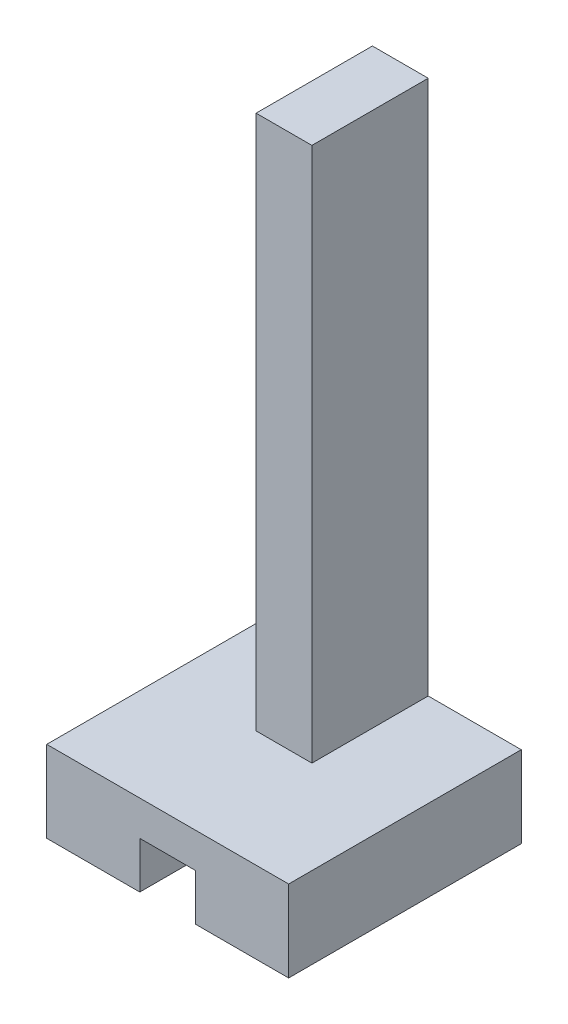
from build123d import *

# Parameters (mm, degrees)
SKIZZE1_W                       = 1040
SKIZZE1_H                       = 350
AUFSATZ_LINEAR_AUSTRAGEN1_DEPTH = 1000
SKIZZE2_W                       = 240
SKIZZE2_H                       = 200
SCHNITT_LINEAR_AUSTRAGEN1_DEPTH = 1485.621163799
SKIZZE3_W                       = 240
SKIZZE3_H                       = 500
AUFSATZ_LINEAR_AUSTRAGEN2_DEPTH = 2300


with BuildPart() as part:
    # Skizze1 → Aufsatz-Linear austragen1 (new body)
    with BuildSketch(Plane.XY):
        with Locations((520, 175)):
            Rectangle(SKIZZE1_W, SKIZZE1_H)
    extrude(amount=AUFSATZ_LINEAR_AUSTRAGEN1_DEPTH)

    # Skizze2 → Schnitt-Linear austragen1 (cut, through all)
    with BuildSketch(Plane.XY.offset(1000)):
        with Locations((520, 100)):
            Rectangle(SKIZZE2_W, SKIZZE2_H)
    extrude(amount=-SCHNITT_LINEAR_AUSTRAGEN1_DEPTH, mode=Mode.SUBTRACT)

    # Skizze3 → Aufsatz-Linear austragen2 (add)
    with BuildSketch(Plane(origin=(0, 350, 0), x_dir=(1, 0, 0), z_dir=(0, 1, 0))):
        with Locations((520, -250)):
            Rectangle(SKIZZE3_W, SKIZZE3_H)
    extrude(amount=AUFSATZ_LINEAR_AUSTRAGEN2_DEPTH)


solid = part.part
